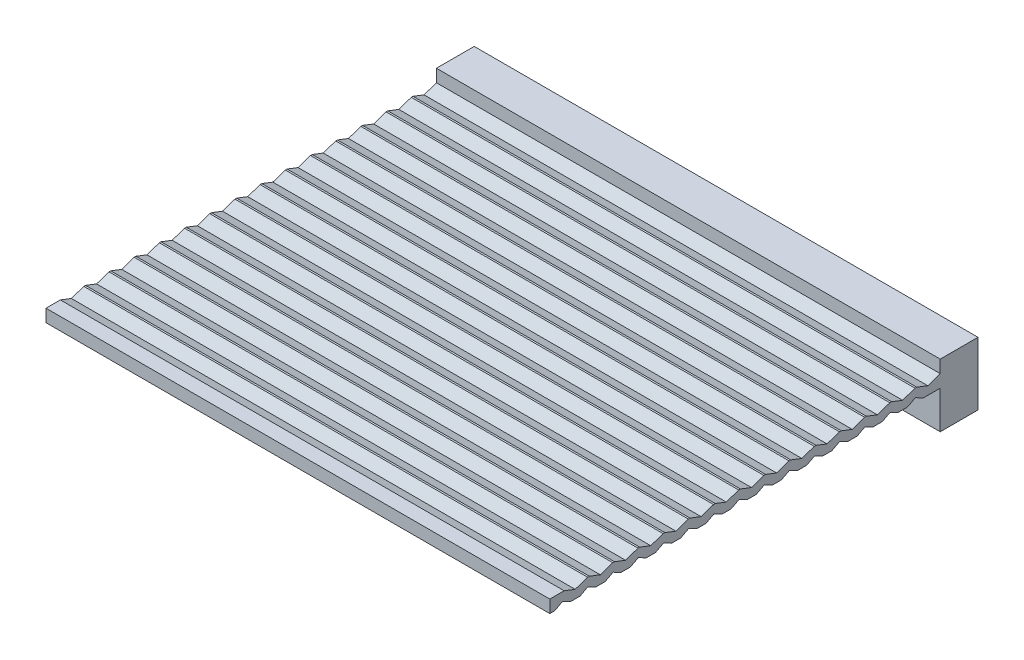
from build123d import *

# Parameters (mm, degrees)
SKETCH1_W           = 400
SKETCH1_H           = 30
BOSS_EXTRUDE1_DEPTH = 50
SKETCH2_W           = 400
SKETCH2_H           = 10
BOSS_EXTRUDE2_DEPTH = 310
CUT_EXTRUDE1_REACH  = 510.527
LPATTERN1_COUNT     = 15
LPATTERN1_PITCH     = 20


with BuildPart() as part:
    # Sketch1 → Boss-Extrude1 (new body)
    with BuildSketch(Plane(origin=(0, 0, 0), x_dir=(1, 0, 0), z_dir=(0, 1, 0))):
        with Locations((200, 15)):
            Rectangle(SKETCH1_W, SKETCH1_H)
    extrude(amount=BOSS_EXTRUDE1_DEPTH)

    # Sketch2 → Boss-Extrude2 (add)
    with BuildSketch(Plane.XY):
        with Locations((200, 35)):
            Rectangle(SKETCH2_W, SKETCH2_H)
    extrude(amount=BOSS_EXTRUDE2_DEPTH)

    # Sketch3 → Cut-Extrude1 (cut, up to next)
    with BuildSketch(Plane.ZY, mode=Mode.PRIVATE) as cut_extrude1_sk1:
        Polygon((0, 40), (9.867375243, 36.624338333), (18.617949732, 40), align=None)
    cut_extrude1_tool1 = extrude(cut_extrude1_sk1.sketch, amount=-CUT_EXTRUDE1_REACH, mode=Mode.PRIVATE) & part.part
    # Sketch3 → Cut-Extrude1 (cut, up to next)
    with BuildSketch(Plane.ZY, mode=Mode.PRIVATE) as cut_extrude1_sk2:
        Polygon((13.283352971, 30), (19.738366334, 33.302751996), (26.012819883, 30), align=None)
    cut_extrude1_tool2 = extrude(cut_extrude1_sk2.sketch, amount=-CUT_EXTRUDE1_REACH, mode=Mode.PRIVATE) & part.part
    cut_extrude1_1 = cut_extrude1_tool1.solids().sort_by_distance((0, 38.874779, 9.495108))[0]
    add(cut_extrude1_1, mode=Mode.SUBTRACT)
    cut_extrude1_2 = cut_extrude1_tool2.solids().sort_by_distance((0, 31.100917, 19.67818))[0]
    add(cut_extrude1_2, mode=Mode.SUBTRACT)
    cut_extrude1 = cut_extrude1_1 + cut_extrude1_2  # Cut-Extrude1 as one shape, for the pattern or mirror that repeats it

    # LPattern1: Cut-Extrude1 ×15
    with Locations(*[(0, 0, i * LPATTERN1_PITCH) for i in range(1, LPATTERN1_COUNT)]):
        add(cut_extrude1, mode=Mode.SUBTRACT)


solid = part.part
